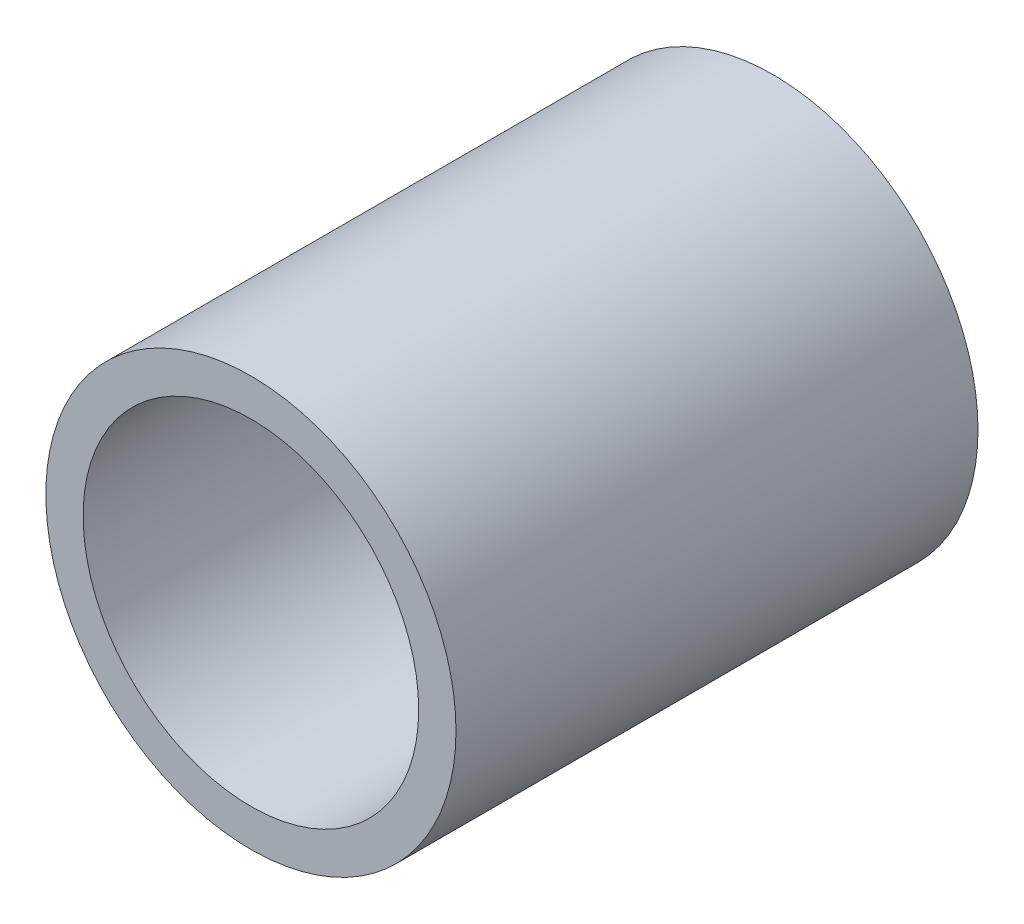
from build123d import *

# Parameters (mm, degrees)
BODY_SKETCH_R      = 5.5
BODY_SKETCH_R_2    = 4.5
BODY_EXTRUDE_DEPTH = 14


with BuildPart() as part:
    # Body Sketch → Body Extrude (new body)
    with BuildSketch(Plane.XY):
        Circle(BODY_SKETCH_R)
        Circle(BODY_SKETCH_R_2, mode=Mode.SUBTRACT)
    extrude(amount=BODY_EXTRUDE_DEPTH)


solid = part.part
